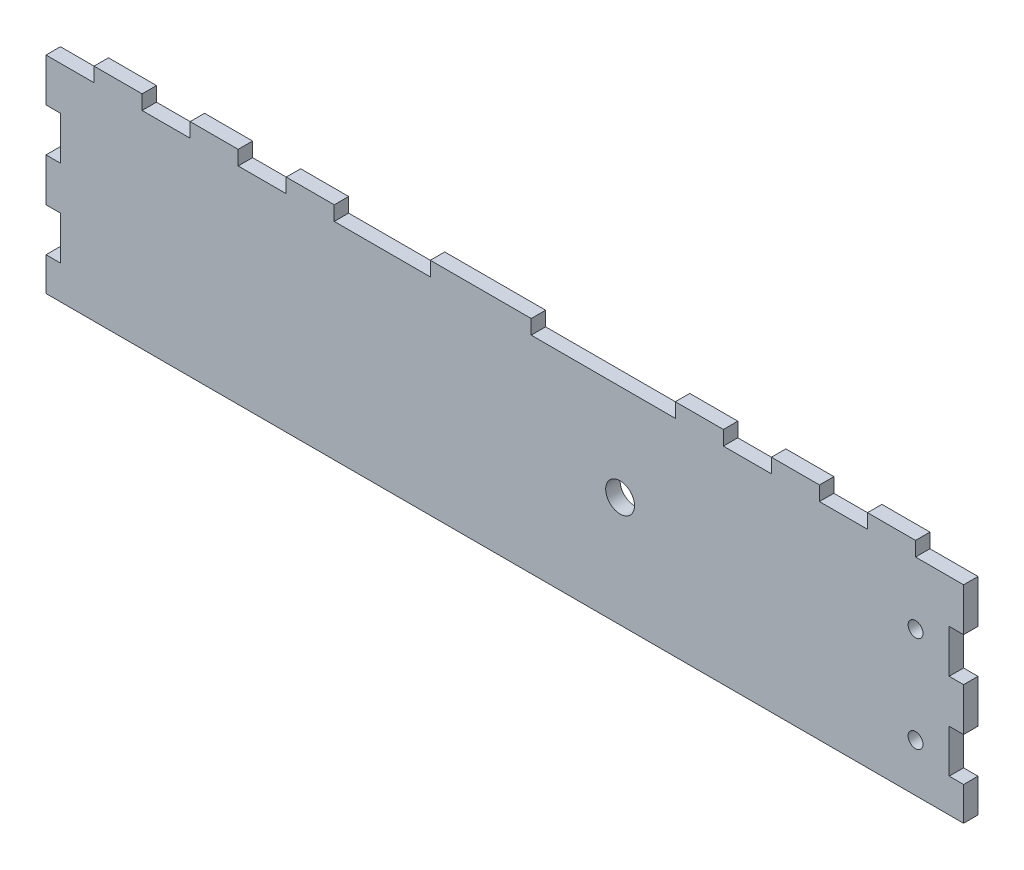
from build123d import *

# Parameters (mm, degrees)
SKETCH1_W           = 191
SKETCH1_H           = 46
SKETCH1_R           = 1.549999948
BOSS_EXTRUDE1_DEPTH = 3
CUT_EXTRUDE1_REACH  = 198.484
SKETCH4_W           = 10
SKETCH4_H           = 3
SKETCH4_W_2         = 20
SKETCH4_W_3         = 30
CUT_EXTRUDE2_REACH  = 198.484
SKETCH5_W           = 3
SKETCH5_H           = 9
CUT_EXTRUDE3_REACH  = 198.484
SKETCH6_W           = 3
SKETCH6_H           = 9
CUT_EXTRUDE4_REACH  = 198.484
SKETCH7_R           = 3


with BuildPart() as part:
    # Sketch1 → Boss-Extrude1 (new body)
    with BuildSketch(Plane.XY):
        with Locations((95.5, 23)):
            Rectangle(SKETCH1_W, SKETCH1_H)
        with Locations((181, 30)):
            Circle(SKETCH1_R, mode=Mode.SUBTRACT)
        with Locations((181, 10)):
            Circle(SKETCH1_R, mode=Mode.SUBTRACT)
    extrude(amount=BOSS_EXTRUDE1_DEPTH)

    # Sketch4 → Cut-Extrude1 (cut, up to next)
    with BuildSketch(Plane(origin=(0, 0, 0), x_dir=(-1, 0, 0), z_dir=(0, 0, -1)), mode=Mode.PRIVATE) as cut_extrude1_sk1:
        with Locations((-5, 44.5)):
            Rectangle(SKETCH4_W, SKETCH4_H)
    cut_extrude1_tool1 = extrude(cut_extrude1_sk1.sketch, amount=-CUT_EXTRUDE1_REACH, mode=Mode.PRIVATE) & part.part
    # Sketch4 → Cut-Extrude1 (cut, up to next)
    with BuildSketch(Plane(origin=(0, 0, 0), x_dir=(-1, 0, 0), z_dir=(0, 0, -1)), mode=Mode.PRIVATE) as cut_extrude1_sk2:
        with Locations((-25, 44.5)):
            Rectangle(SKETCH4_W, SKETCH4_H)
    cut_extrude1_tool2 = extrude(cut_extrude1_sk2.sketch, amount=-CUT_EXTRUDE1_REACH, mode=Mode.PRIVATE) & part.part
    # Sketch4 → Cut-Extrude1 (cut, up to next)
    with BuildSketch(Plane(origin=(0, 0, 0), x_dir=(-1, 0, 0), z_dir=(0, 0, -1)), mode=Mode.PRIVATE) as cut_extrude1_sk3:
        with Locations((-45, 44.5)):
            Rectangle(SKETCH4_W, SKETCH4_H)
    cut_extrude1_tool3 = extrude(cut_extrude1_sk3.sketch, amount=-CUT_EXTRUDE1_REACH, mode=Mode.PRIVATE) & part.part
    # Sketch4 → Cut-Extrude1 (cut, up to next)
    with BuildSketch(Plane(origin=(0, 0, 0), x_dir=(-1, 0, 0), z_dir=(0, 0, -1)), mode=Mode.PRIVATE) as cut_extrude1_sk4:
        with Locations((-70, 44.5)):
            Rectangle(SKETCH4_W_2, SKETCH4_H)
    cut_extrude1_tool4 = extrude(cut_extrude1_sk4.sketch, amount=-CUT_EXTRUDE1_REACH, mode=Mode.PRIVATE) & part.part
    # Sketch4 → Cut-Extrude1 (cut, up to next)
    with BuildSketch(Plane(origin=(0, 0, 0), x_dir=(-1, 0, 0), z_dir=(0, 0, -1)), mode=Mode.PRIVATE) as cut_extrude1_sk5:
        with Locations((-116, 44.5)):
            Rectangle(SKETCH4_W_3, SKETCH4_H)
    cut_extrude1_tool5 = extrude(cut_extrude1_sk5.sketch, amount=-CUT_EXTRUDE1_REACH, mode=Mode.PRIVATE) & part.part
    # Sketch4 → Cut-Extrude1 (cut, up to next)
    with BuildSketch(Plane(origin=(0, 0, 0), x_dir=(-1, 0, 0), z_dir=(0, 0, -1)), mode=Mode.PRIVATE) as cut_extrude1_sk6:
        with Locations((-146, 44.5)):
            Rectangle(SKETCH4_W, SKETCH4_H)
    cut_extrude1_tool6 = extrude(cut_extrude1_sk6.sketch, amount=-CUT_EXTRUDE1_REACH, mode=Mode.PRIVATE) & part.part
    # Sketch4 → Cut-Extrude1 (cut, up to next)
    with BuildSketch(Plane(origin=(0, 0, 0), x_dir=(-1, 0, 0), z_dir=(0, 0, -1)), mode=Mode.PRIVATE) as cut_extrude1_sk7:
        with Locations((-166, 44.5)):
            Rectangle(SKETCH4_W, SKETCH4_H)
    cut_extrude1_tool7 = extrude(cut_extrude1_sk7.sketch, amount=-CUT_EXTRUDE1_REACH, mode=Mode.PRIVATE) & part.part
    # Sketch4 → Cut-Extrude1 (cut, up to next)
    with BuildSketch(Plane(origin=(0, 0, 0), x_dir=(-1, 0, 0), z_dir=(0, 0, -1)), mode=Mode.PRIVATE) as cut_extrude1_sk8:
        with Locations((-186, 44.5)):
            Rectangle(SKETCH4_W, SKETCH4_H)
    cut_extrude1_tool8 = extrude(cut_extrude1_sk8.sketch, amount=-CUT_EXTRUDE1_REACH, mode=Mode.PRIVATE) & part.part
    add(cut_extrude1_tool1.solids().sort_by_distance((5, 44.5, 0))[0], mode=Mode.SUBTRACT)
    add(cut_extrude1_tool2.solids().sort_by_distance((25, 44.5, 0))[0], mode=Mode.SUBTRACT)
    add(cut_extrude1_tool3.solids().sort_by_distance((45, 44.5, 0))[0], mode=Mode.SUBTRACT)
    add(cut_extrude1_tool4.solids().sort_by_distance((70, 44.5, 0))[0], mode=Mode.SUBTRACT)
    add(cut_extrude1_tool5.solids().sort_by_distance((116, 44.5, 0))[0], mode=Mode.SUBTRACT)
    add(cut_extrude1_tool6.solids().sort_by_distance((146, 44.5, 0))[0], mode=Mode.SUBTRACT)
    add(cut_extrude1_tool7.solids().sort_by_distance((166, 44.5, 0))[0], mode=Mode.SUBTRACT)
    add(cut_extrude1_tool8.solids().sort_by_distance((186, 44.5, 0))[0], mode=Mode.SUBTRACT)

    # Sketch5 → Cut-Extrude2 (cut, up to next)
    with BuildSketch(Plane(origin=(0, 0, 0), x_dir=(-1, 0, 0), z_dir=(0, 0, -1)), mode=Mode.PRIVATE) as cut_extrude2_sk1:
        with Locations((-1.5, 29.5)):
            Rectangle(SKETCH5_W, SKETCH5_H)
    cut_extrude2_tool1 = extrude(cut_extrude2_sk1.sketch, amount=-CUT_EXTRUDE2_REACH, mode=Mode.PRIVATE) & part.part
    # Sketch5 → Cut-Extrude2 (cut, up to next)
    with BuildSketch(Plane(origin=(0, 0, 0), x_dir=(-1, 0, 0), z_dir=(0, 0, -1)), mode=Mode.PRIVATE) as cut_extrude2_sk2:
        with Locations((-1.5, 11.5)):
            Rectangle(SKETCH5_W, SKETCH5_H)
    cut_extrude2_tool2 = extrude(cut_extrude2_sk2.sketch, amount=-CUT_EXTRUDE2_REACH, mode=Mode.PRIVATE) & part.part
    add(cut_extrude2_tool1.solids().sort_by_distance((1.5, 29.5, 0))[0], mode=Mode.SUBTRACT)
    add(cut_extrude2_tool2.solids().sort_by_distance((1.5, 11.5, 0))[0], mode=Mode.SUBTRACT)

    # Sketch6 → Cut-Extrude3 (cut, up to next)
    with BuildSketch(Plane(origin=(0, 0, 0), x_dir=(-1, 0, 0), z_dir=(0, 0, -1)), mode=Mode.PRIVATE) as cut_extrude3_sk1:
        with Locations((-189.5, 29.5)):
            Rectangle(SKETCH6_W, SKETCH6_H)
    cut_extrude3_tool1 = extrude(cut_extrude3_sk1.sketch, amount=-CUT_EXTRUDE3_REACH, mode=Mode.PRIVATE) & part.part
    # Sketch6 → Cut-Extrude3 (cut, up to next)
    with BuildSketch(Plane(origin=(0, 0, 0), x_dir=(-1, 0, 0), z_dir=(0, 0, -1)), mode=Mode.PRIVATE) as cut_extrude3_sk2:
        with Locations((-189.5, 11.5)):
            Rectangle(SKETCH6_W, SKETCH6_H)
    cut_extrude3_tool2 = extrude(cut_extrude3_sk2.sketch, amount=-CUT_EXTRUDE3_REACH, mode=Mode.PRIVATE) & part.part
    add(cut_extrude3_tool1.solids().sort_by_distance((189.5, 29.5, 0))[0], mode=Mode.SUBTRACT)
    add(cut_extrude3_tool2.solids().sort_by_distance((189.5, 11.5, 0))[0], mode=Mode.SUBTRACT)

    # Sketch7 → Cut-Extrude4 (cut, up to next)
    with BuildSketch(Plane.XY.offset(3), mode=Mode.PRIVATE) as cut_extrude4_sk1:
        with Locations((119.5, 23)):
            Circle(SKETCH7_R)
    cut_extrude4_tool1 = extrude(cut_extrude4_sk1.sketch, amount=-CUT_EXTRUDE4_REACH, mode=Mode.PRIVATE) & part.part
    add(cut_extrude4_tool1.solids().sort_by_distance((119.5, 23, 3))[0], mode=Mode.SUBTRACT)


solid = part.part
